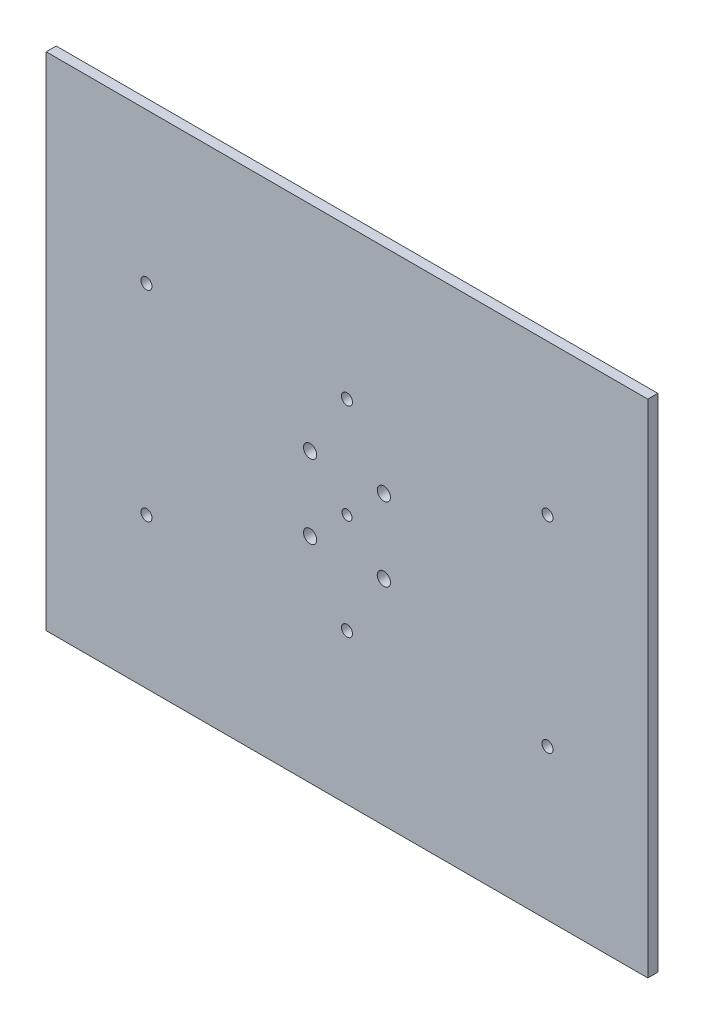
from build123d import *

# Parameters (mm, degrees)
SKETCH_1_W          = 300
SKETCH_1_H          = 250
SKETCH_1_R          = 3.3
SKETCH_1_R_2        = 2.5
EXTRUDE_1_DEPTH     = 5
SKETCH_2_R          = 2.75
CUT_EXTRUDE_1_DEPTH = 196.320249846


with BuildPart() as part:
    # 草图1 → 凸台-拉伸1 (new body)
    with BuildSketch(Plane.XY):
        Rectangle(SKETCH_1_W, SKETCH_1_H)
        with Locations((-18.384776311, 18.384776311)):
            Circle(SKETCH_1_R, mode=Mode.SUBTRACT)
        with Locations((18.384776311, 18.384776311)):
            Circle(SKETCH_1_R, mode=Mode.SUBTRACT)
        with Locations((18.384776311, -18.384776311)):
            Circle(SKETCH_1_R, mode=Mode.SUBTRACT)
        with Locations((-18.384776311, -18.384776311)):
            Circle(SKETCH_1_R, mode=Mode.SUBTRACT)
        Circle(SKETCH_1_R_2, mode=Mode.SUBTRACT)
    extrude(amount=EXTRUDE_1_DEPTH)

    # 草图2 → 切除-拉伸1 (cut, through all)
    with BuildSketch(Plane.XY.offset(5)):
        with Locations((-100, 50)):
            Circle(SKETCH_2_R)
        with Locations((0, 50)):
            Circle(SKETCH_2_R)
        with Locations((100, 50)):
            Circle(SKETCH_2_R)
        with Locations((100, -50)):
            Circle(SKETCH_2_R)
        with Locations((0, -50)):
            Circle(SKETCH_2_R)
        with Locations((-100, -50)):
            Circle(SKETCH_2_R)
    extrude(amount=-CUT_EXTRUDE_1_DEPTH, mode=Mode.SUBTRACT)


solid = part.part
